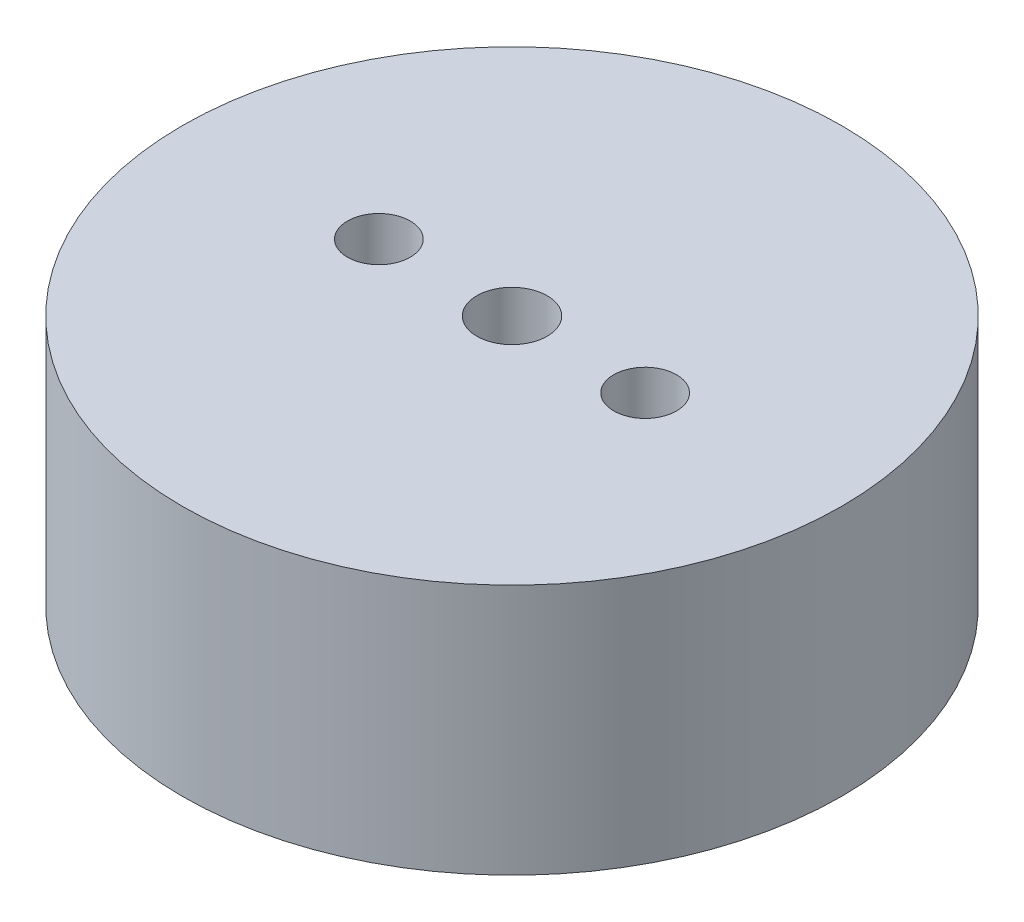
from build123d import *

# Parameters (mm, degrees)
SKETCH1_R           = 33.3375
BOSS_EXTRUDE1_DEPTH = 25.4
SKETCH2_R           = 3.556
CUT_EXTRUDE1_DEPTH  = 54.553130744
SKETCH3_R           = 3.175
CUT_EXTRUDE2_DEPTH  = 54.553130744


with BuildPart() as part:
    # Sketch1 → Boss-Extrude1 (new body)
    with BuildSketch(Plane(origin=(0, 0, 0), x_dir=(1, 0, 0), z_dir=(0, 1, 0))):
        Circle(SKETCH1_R)
    extrude(amount=BOSS_EXTRUDE1_DEPTH)

    # Sketch2 → Cut-Extrude1 (cut, through all)
    with BuildSketch(Plane(origin=(0, 25.4, 0), x_dir=(1, 0, 0), z_dir=(0, 1, 0))):
        Circle(SKETCH2_R)
    extrude(amount=-CUT_EXTRUDE1_DEPTH, mode=Mode.SUBTRACT)

    # Sketch3 → Cut-Extrude2 (cut, through all)
    with BuildSketch(Plane(origin=(0, 25.4, 0), x_dir=(-1, 0, 0), z_dir=(0, 1, 0))):
        with Locations((13.462, 0)):
            Circle(SKETCH3_R)
        with Locations((-13.462, 0)):
            Circle(SKETCH3_R)
    extrude(amount=-CUT_EXTRUDE2_DEPTH, mode=Mode.SUBTRACT)


solid = part.part
